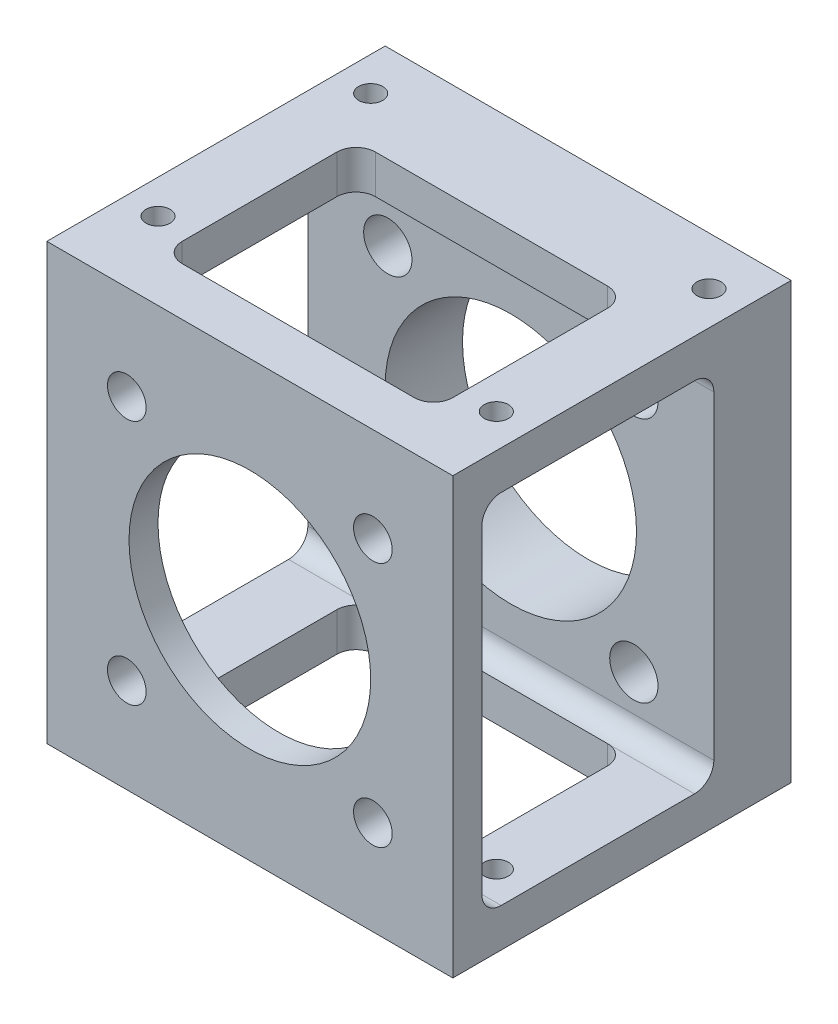
from build123d import *

# Parameters (mm, degrees)
SKETCH_1_W             = 42
SKETCH_1_H             = 45
SKETCH_1_R             = 12.5
EXTRUDE_1_DEPTH        = 35
SKETCH_3_W             = 24
SKETCH_3_H             = 37
CUT_EXTRUDE_1_DEPTH    = 71.809603868
HOLE_WIZARD_M3_2_D     = 2.5
HOLE_WIZARD_M3_2_DEPTH = 6
HOLE_WIZARD_M3_2_TIP   = 0.751075774
HOLE_WIZARD_M3_4_D     = 2.5
HOLE_WIZARD_M3_4_DEPTH = 6
HOLE_WIZARD_M3_4_TIP   = 0.751075774
SKETCH_18_W            = 28
SKETCH_18_H            = 20
CUT_EXTRUDE_8_DEPTH    = 71.809603868
SKETCH_13_R            = 2
CUT_EXTRUDE_10_DEPTH   = 71.809603868
FILLET_3_DEPTH         = 42
FILLET_7_R             = 2
CUT_EXTRUDE_9_REACH    = 72.81
SKETCH_12_R            = 13
SKETCH_12_R_2          = 12.5
SKETCH_12_R_3          = 2.5


with BuildPart() as part:
    # 草图1 → 凸台-拉伸1 (new body)
    with BuildSketch(Plane.XY):
        with Locations((21, 22.5)):
            Rectangle(SKETCH_1_W, SKETCH_1_H)
        with Locations((21, 22.5)):
            Circle(SKETCH_1_R, mode=Mode.SUBTRACT)
    extrude(amount=EXTRUDE_1_DEPTH)

    # 草图3 → 切除-拉伸1 (cut, through all)
    with BuildSketch(Plane.ZY):
        with Locations((20, 22.5)):
            Rectangle(SKETCH_3_W, SKETCH_3_H)
    extrude(amount=-CUT_EXTRUDE_1_DEPTH, mode=Mode.SUBTRACT)

    # M3 螺纹孔2
    with Locations(Plane(origin=(3.5, 45, 5), x_dir=(0, 0, 1), z_dir=(0, 1, 0))):
        with Locations((0, 0), (0, 35), (22, 35), (22, 0)):
            Hole(HOLE_WIZARD_M3_2_D / 2, depth=HOLE_WIZARD_M3_2_DEPTH)
            with Locations((0, 0, -(HOLE_WIZARD_M3_2_DEPTH + HOLE_WIZARD_M3_2_TIP / 2))):  # 118° drill point
                Cone(0, HOLE_WIZARD_M3_2_D / 2, HOLE_WIZARD_M3_2_TIP, mode=Mode.SUBTRACT)

    # M3 螺纹孔4
    with Locations(Plane(origin=(3.5, 0, 5), x_dir=(0, 0, -1), z_dir=(0, -1, 0))):
        with Locations((0, 0), (-22, 0), (-22, 35), (0, 35)):
            Hole(HOLE_WIZARD_M3_4_D / 2, depth=HOLE_WIZARD_M3_4_DEPTH)
            with Locations((0, 0, -(HOLE_WIZARD_M3_4_DEPTH + HOLE_WIZARD_M3_4_TIP / 2))):  # 118° drill point
                Cone(0, HOLE_WIZARD_M3_4_D / 2, HOLE_WIZARD_M3_4_TIP, mode=Mode.SUBTRACT)

    # 草图18 → 切除-拉伸8 (cut, through all)
    with BuildSketch(Plane(origin=(0, 45, 0), x_dir=(1, 0, 0), z_dir=(0, 1, 0))):
        with Locations((21, -20)):
            Rectangle(SKETCH_18_W, SKETCH_18_H)
    extrude(amount=-CUT_EXTRUDE_8_DEPTH, mode=Mode.SUBTRACT)

    # 草图13 → 切除-拉伸10 (cut, through all)
    with BuildSketch(Plane.XY.offset(35)):
        with Locations((33.727922061, 9.772077939)):
            Circle(SKETCH_13_R)
        with Locations((33.727922061, 35.227922061)):
            Circle(SKETCH_13_R)
        with Locations((8.272077939, 35.227922061)):
            Circle(SKETCH_13_R)
        with Locations((8.272077939, 9.772077939)):
            Circle(SKETCH_13_R)
    extrude(amount=-CUT_EXTRUDE_10_DEPTH, mode=Mode.SUBTRACT)

    # 圆角3: read off the stored shape, not the designer's step
    # 圆角3 outline → 圆角3 (add)
    with BuildSketch(Plane.YZ):
        with BuildLine():
            ThreePointArc((41, 10), (40.414213562, 8.585786438), (39, 8))
            Line((39, 8), (41, 8))
            Line((41, 8), (41, 10))
        make_face()
        with BuildLine():
            Line((4, 8), (6, 8))
            ThreePointArc((6, 8), (4.585786438, 8.585786438), (4, 10))
            Line((4, 10), (4, 8))
        make_face()
        with BuildLine():
            ThreePointArc((39, 32), (40.414213562, 31.414213562), (41, 30))
            Line((41, 30), (41, 32))
            Line((41, 32), (39, 32))
        make_face()
        with BuildLine():
            Line((4, 32), (4, 30))
            ThreePointArc((4, 30), (4.585786438, 31.414213562), (6, 32))
            Line((6, 32), (4, 32))
        make_face()
    extrude(amount=FILLET_3_DEPTH)

    # 圆角7
    fillet_7_edges = [part.edges().sort_by_distance(p)[0] for p in [
        (35, 2, 10),
        (35, 43, 10),
        (35, 2, 30),
        (35, 43, 30),
        (7, 2, 30),
        (7, 43, 30),
        (7, 2, 10),
        (7, 43, 10),
    ]]
    fillet(fillet_7_edges, radius=FILLET_7_R)

    # 草图12 → 切除-拉伸9 (cut, up to next)
    with BuildSketch(Plane(origin=(0, 0, 0), x_dir=(-1, 0, 0), z_dir=(0, 0, -1)), mode=Mode.PRIVATE) as cut_extrude_9_sk1:
        with Locations((-21, 22.5)):
            Circle(SKETCH_12_R)
        with Locations(Location((-21, 22.5, 0), (0, 0, 180))):
            Circle(SKETCH_12_R_2, mode=Mode.SUBTRACT)
    cut_extrude_9_tool1 = extrude(cut_extrude_9_sk1.sketch, amount=-CUT_EXTRUDE_9_REACH, mode=Mode.PRIVATE) & part.part
    # 草图12 → 切除-拉伸9 (cut, up to next)
    with BuildSketch(Plane(origin=(0, 0, 0), x_dir=(-1, 0, 0), z_dir=(0, 0, -1)), mode=Mode.PRIVATE) as cut_extrude_9_sk2:
        with Locations((-8.272077939, 35.227922061)):
            Circle(SKETCH_12_R_3)
    cut_extrude_9_tool2 = extrude(cut_extrude_9_sk2.sketch, amount=-CUT_EXTRUDE_9_REACH, mode=Mode.PRIVATE) & part.part
    # 草图12 → 切除-拉伸9 (cut, up to next)
    with BuildSketch(Plane(origin=(0, 0, 0), x_dir=(-1, 0, 0), z_dir=(0, 0, -1)), mode=Mode.PRIVATE) as cut_extrude_9_sk3:
        with Locations((-8.272077939, 9.772077939)):
            Circle(SKETCH_12_R_3)
    cut_extrude_9_tool3 = extrude(cut_extrude_9_sk3.sketch, amount=-CUT_EXTRUDE_9_REACH, mode=Mode.PRIVATE) & part.part
    # 草图12 → 切除-拉伸9 (cut, up to next)
    with BuildSketch(Plane(origin=(0, 0, 0), x_dir=(-1, 0, 0), z_dir=(0, 0, -1)), mode=Mode.PRIVATE) as cut_extrude_9_sk4:
        with Locations((-33.727922061, 9.772077939)):
            Circle(SKETCH_12_R_3)
    cut_extrude_9_tool4 = extrude(cut_extrude_9_sk4.sketch, amount=-CUT_EXTRUDE_9_REACH, mode=Mode.PRIVATE) & part.part
    # 草图12 → 切除-拉伸9 (cut, up to next)
    with BuildSketch(Plane(origin=(0, 0, 0), x_dir=(-1, 0, 0), z_dir=(0, 0, -1)), mode=Mode.PRIVATE) as cut_extrude_9_sk5:
        with Locations((-33.727922061, 35.227922061)):
            Circle(SKETCH_12_R_3)
    cut_extrude_9_tool5 = extrude(cut_extrude_9_sk5.sketch, amount=-CUT_EXTRUDE_9_REACH, mode=Mode.PRIVATE) & part.part
    add(cut_extrude_9_tool1.solids().sort_by_distance((33.632304, 22.5, 0))[0], mode=Mode.SUBTRACT)
    add(cut_extrude_9_tool2.solids().sort_by_distance((8.272078, 35.227922, 0))[0], mode=Mode.SUBTRACT)
    add(cut_extrude_9_tool3.solids().sort_by_distance((8.272078, 9.772078, 0))[0], mode=Mode.SUBTRACT)
    add(cut_extrude_9_tool4.solids().sort_by_distance((33.727922, 9.772078, 0))[0], mode=Mode.SUBTRACT)
    add(cut_extrude_9_tool5.solids().sort_by_distance((33.727922, 35.227922, 0))[0], mode=Mode.SUBTRACT)


solid = part.part
